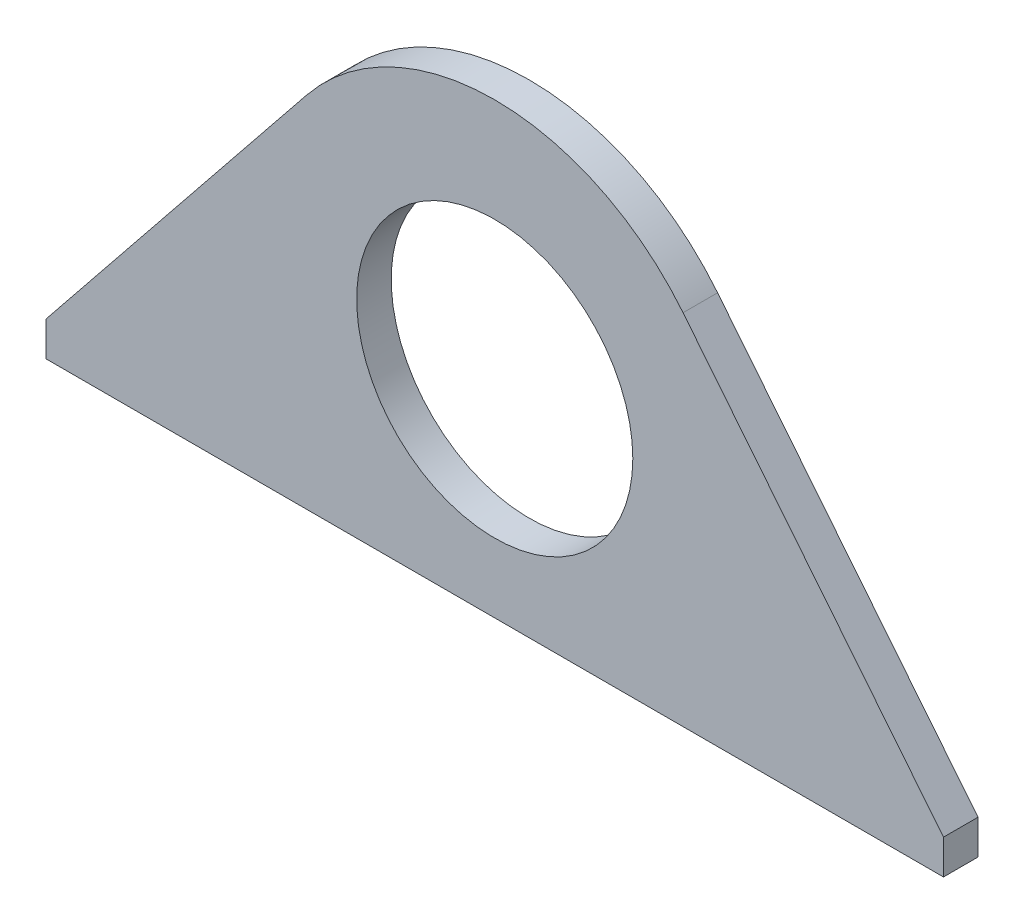
from build123d import *

# Parameters (mm, degrees)
EXTRUDE_1_DEPTH      = 2.5
EXTRUDE_1_DEPTH_BACK = 2.5
SKETCH_1_R           = 20


with BuildPart() as part:
    # Эскиз1 → Бобышка-Вытянуть1 (new, two sides: drawn at the far end of the back side and taken through both)
    with BuildSketch(Plane.XY.offset(-EXTRUDE_1_DEPTH_BACK)):
        with BuildLine():
            Line((-65, 5), (-27.279788924, 51.927451203))
            ThreePointArc((-27.279788924, 51.927451203), (0, 65), (27.279788924, 51.927451203))
            Line((27.279788924, 51.927451203), (65, 5))
            Line((65, 5), (65, 0))
            Line((65, 0), (-65, 0))
            Line((-65, 0), (-65, 5))
        make_face()
        with Locations((0, 30)):
            Circle(SKETCH_1_R, mode=Mode.SUBTRACT)
    extrude(amount=EXTRUDE_1_DEPTH + EXTRUDE_1_DEPTH_BACK)


solid = part.part
